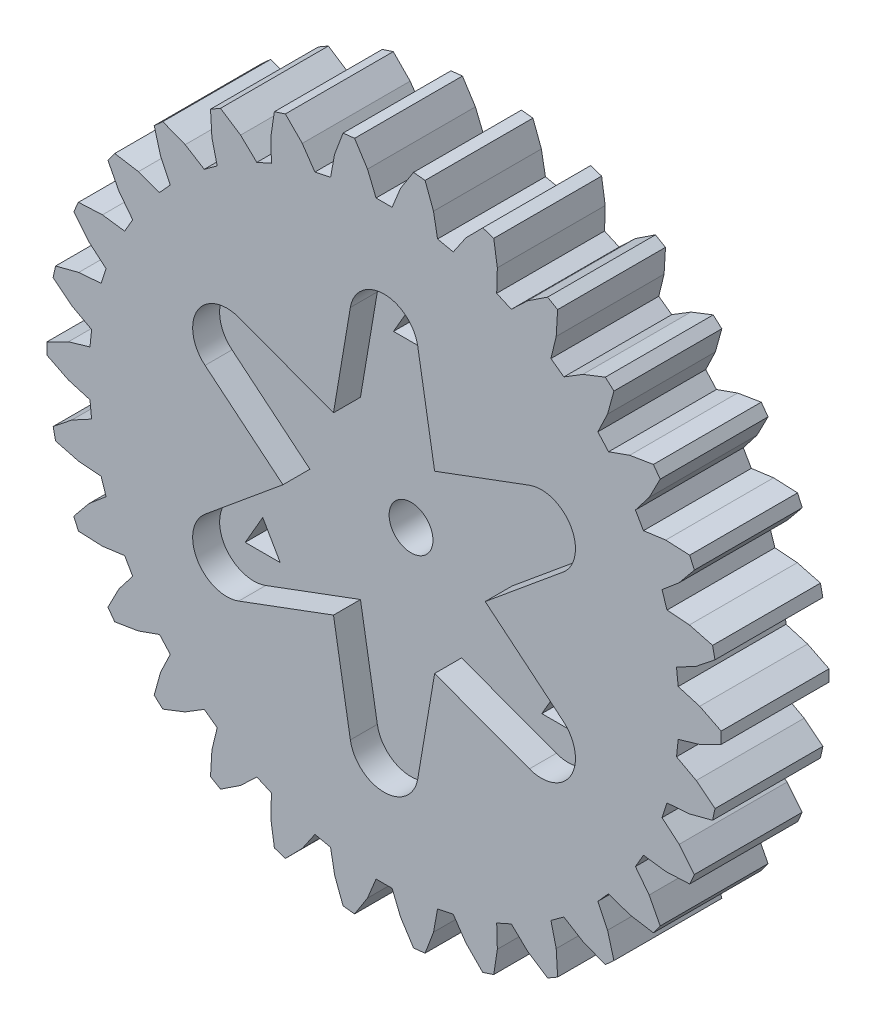
from build123d import *

# Parameters (mm, degrees)
BOSS_EXTRUDE1_DEPTH = 8
CUT_EXTRUDE4_DEPTH  = 2
SKETCH5_R           = 1.625
CUT_EXTRUDE5_DEPTH  = 114.938091431
SKETCH7_R           = 2.875
CUT_EXTRUDE6_DEPTH  = 1.5
CUT_EXTRUDE7_DEPTH  = 114.938091431


with BuildPart() as part:
    # Sketch1 → Boss-Extrude1 (new body)
    with BuildSketch(Plane.XY):
        Polygon((67.838691437, 65.517866318), (69.4350027, 65.049749419), (71.026159174, 64.251961707), (71.026159174, 63.394033481), (69.4350027, 62.596245769), (67.838691437, 62.12812887), (67.714359377, 60.945685054), (69.178606177, 60.155998099), (70.569088563, 59.044741521), (70.390752331, 58.205591984), (68.668390309, 57.75600806), (67.009606199, 57.630080376), (66.642255801, 56.499308835), (67.91024703, 55.42254103), (69.039300308, 54.046418819), (68.690360246, 53.262746436), (66.912276224, 53.181003905), (65.263556413, 53.40278858), (64.669020401, 52.373151894), (65.685401977, 51.056188644), (66.503808846, 49.475342184), (65.999484477, 48.781390015), (64.243247317, 49.071170681), (62.676638392, 49.630849566), (61.881060372, 48.747269162), (62.601400993, 47.247796879), (63.073200133, 45.531449431), (62.435706672, 44.957410372), (60.778026756, 45.60595012), (59.362138343, 46.47909787), (58.400251933, 45.780236192), (58.793008793, 44.163795895), (58.89770325, 42.386816503), (58.154779059, 41.957852172), (56.668193967, 42.936921648), (55.464639564, 44.08536725), (54.378544169, 43.601785548), (54.426656842, 41.938950842), (54.159581951, 40.179154516), (53.343629619, 39.914043603), (52.093189812, 41.180807128), (51.154746322, 42.554351727), (49.99181747, 42.307160589), (49.693199773, 40.670591694), (49.066015892, 39.004811457), (48.21275146, 38.915090809), (47.252951668, 40.414194737), (46.620736072, 41.952820022), (45.431664484, 41.952820022), (44.799448453, 40.414194737), (43.839648661, 38.915090809), (42.986384664, 39.004811457), (42.359200783, 40.670591694), (42.060582651, 42.307160589), (40.897654234, 42.554351727), (39.959210744, 41.180807128), (38.708770937, 39.914043603), (37.89281817, 40.179154516), (37.625743714, 41.938950842), (37.673856387, 43.601785548), (36.587760557, 44.08536725), (35.384206154, 42.936921648), (33.897621497, 41.957852172), (33.154697306, 42.386816503), (33.259391328, 44.163795895), (33.652148188, 45.780236192), (32.690262213, 46.47909787), (31.274373365, 45.60595012), (29.616693883, 44.957410372), (28.979200423, 45.531449431), (29.450999563, 47.247796879), (30.171340183, 48.747269162), (29.375762164, 49.630849566), (27.809152804, 49.071170681), (26.052915644, 48.781390015), (25.548591275, 49.475342184), (26.366998579, 51.056188644), (27.38337972, 52.373151894), (26.788844143, 53.40278858), (25.140124332, 53.181003905), (23.362039875, 53.262746436), (23.013100248, 54.046418819), (24.142153526, 55.42254103), (25.410144754, 56.499308835), (25.042794357, 57.630080376), (23.384009811, 57.75600806), (21.661648225, 58.205591984), (21.483311993, 59.044741521), (22.873793943, 60.155998099), (24.338041179, 60.945685054), (24.213708684, 62.12812887), (22.617397421, 62.596245769), (21.026240947, 63.394033481), (21.026240947, 64.251961707), (22.617397421, 65.049749419), (24.213708684, 65.517866318), (24.338041179, 66.700310134), (22.873793943, 67.489997089), (21.483311993, 68.601253667), (21.661648225, 69.440403204), (23.384009811, 69.889987128), (25.042794357, 70.015914812), (25.410144754, 71.146686788), (24.142153526, 72.223454158), (23.013100248, 73.599576369), (23.362039875, 74.383249187), (25.140124332, 74.464991718), (26.788844143, 74.243206608), (27.38337972, 75.272843294), (26.366998579, 76.589806544), (25.548591275, 78.170653004), (26.052915644, 78.864605173), (27.809152804, 78.574824507), (29.375762164, 78.015145622), (30.171340183, 78.898726027), (29.450999563, 80.398198309), (28.979200423, 82.114546192), (29.616693883, 82.688584816), (31.274373365, 82.040045068), (32.690262213, 81.166897318), (33.652148188, 81.865758997), (33.259391328, 83.482199293), (33.154697306, 85.259178685), (33.897621497, 85.688143016), (35.384206154, 84.70907354), (36.587760557, 83.560627938), (37.673856387, 84.04420964), (37.625743714, 85.707044346), (37.89281817, 87.466840672), (38.708770937, 87.731951585), (39.959210744, 86.465188061), (40.897654234, 85.091643462), (42.060582651, 85.338834599), (42.359200783, 86.975403494), (42.986384664, 88.641183731), (43.839648661, 88.730904379), (44.799448453, 87.231800451), (45.431664484, 85.693175166), (46.620736072, 85.693175166), (47.252951668, 87.231800451), (48.21275146, 88.730904379), (49.066015892, 88.641183731), (49.693199773, 86.975403494), (49.99181747, 85.338834599), (51.154746322, 85.091643462), (52.093189812, 86.465188061), (53.343629619, 87.731951585), (54.159581951, 87.466840672), (54.426656842, 85.707044346), (54.378544169, 84.04420964), (55.464639564, 83.560627938), (56.668193967, 84.70907354), (58.154779059, 85.688143016), (58.89770325, 85.259178685), (58.793008793, 83.482199293), (58.400251933, 81.865758997), (59.362138343, 81.166897318), (60.778026756, 82.040045068), (62.435706672, 82.688584816), (63.073200133, 82.114546192), (62.601400993, 80.398198309), (61.881060372, 78.898726027), (62.676638392, 78.015145622), (64.243247317, 78.574824507), (65.999484477, 78.864605173), (66.503808846, 78.170653004), (65.685401977, 76.589806544), (64.669020401, 75.272843294), (65.263556413, 74.243206608), (66.912276224, 74.464991718), (68.690360246, 74.383249187), (69.039300308, 73.599576369), (67.91024703, 72.223454158), (66.642255801, 71.146686788), (67.009606199, 70.015914812), (68.668390309, 69.889987128), (70.390752331, 69.440403204), (70.569088563, 68.601253667), (69.178606177, 67.489997089), (67.714359377, 66.700310134), align=None)
    extrude(amount=-BOSS_EXTRUDE1_DEPTH)

    # Sketch4 → Cut-Extrude4 (cut)
    with BuildSketch(Plane.XY):
        with BuildLine():
            Line((42.276200169, 70.318188122), (43.526200169, 77.710256367))
            ThreePointArc((43.526200169, 77.710256367), (46.026200169, 79.822997594), (48.526200169, 77.710256367))
            Line((48.526200169, 77.710256367), (49.776200169, 70.318188122))
            Line((49.776200169, 70.318188122), (56.802919056, 72.93169049))
            ThreePointArc((56.802919056, 72.93169049), (59.88260663, 71.822997594), (59.302919056, 68.601563471))
            Line((59.302919056, 68.601563471), (53.526200169, 63.822997594))
            Line((53.526200169, 63.822997594), (59.302919056, 59.044431717))
            ThreePointArc((59.302919056, 59.044431717), (59.88260663, 55.822997594), (56.802919056, 54.714304698))
            Line((56.802919056, 54.714304698), (49.776200169, 57.327807066))
            Line((49.776200169, 57.327807066), (48.526200169, 49.935738821))
            ThreePointArc((48.526200169, 49.935738821), (46.026200169, 47.822997594), (43.526200169, 49.935738821))
            Line((43.526200169, 49.935738821), (42.276200169, 57.327807066))
            Line((42.276200169, 57.327807066), (35.249481283, 54.714304698))
            ThreePointArc((35.249481283, 54.714304698), (32.169793709, 55.822997594), (32.749481283, 59.044431717))
            Line((32.749481283, 59.044431717), (38.526200169, 63.822997594))
            Line((38.526200169, 63.822997594), (32.749481283, 68.601563471))
            ThreePointArc((32.749481283, 68.601563471), (32.169793709, 71.822997594), (35.249481283, 72.93169049))
            Line((35.249481283, 72.93169049), (42.276200169, 70.318188122))
        make_face()
    extrude(amount=-CUT_EXTRUDE4_DEPTH, mode=Mode.SUBTRACT)

    # Sketch5 → Cut-Extrude5 (cut, through all)
    with BuildSketch(Plane.XY):
        with Locations((46.026200169, 63.822997594)):
            Circle(SKETCH5_R)
    extrude(amount=-CUT_EXTRUDE5_DEPTH, mode=Mode.SUBTRACT)

    # Sketch7 → Cut-Extrude6 (cut)
    with BuildSketch(Plane(origin=(0, 0, -8), x_dir=(-1, 0, 0), z_dir=(0, 0, -1))):
        with Locations((-46.026200169, 63.822997594)):
            Circle(SKETCH7_R)
    extrude(amount=-CUT_EXTRUDE6_DEPTH, mode=Mode.SUBTRACT)

    # Sketch9 → Cut-Extrude7 (cut, through all)
    with BuildSketch(Plane.XY):
        Polygon((57.024722797, 58.972997594), (55.725684692, 56.722997594), (58.323760903, 56.722997594), align=None)
        Polygon((47.325238275, 75.772997594), (46.026200169, 78.022997594), (44.727162064, 75.772997594), align=None)
        Polygon((36.326715647, 56.722997594), (35.027677541, 58.972997594), (33.728639435, 56.722997594), align=None)
    extrude(amount=-CUT_EXTRUDE7_DEPTH, mode=Mode.SUBTRACT)


solid = part.part
